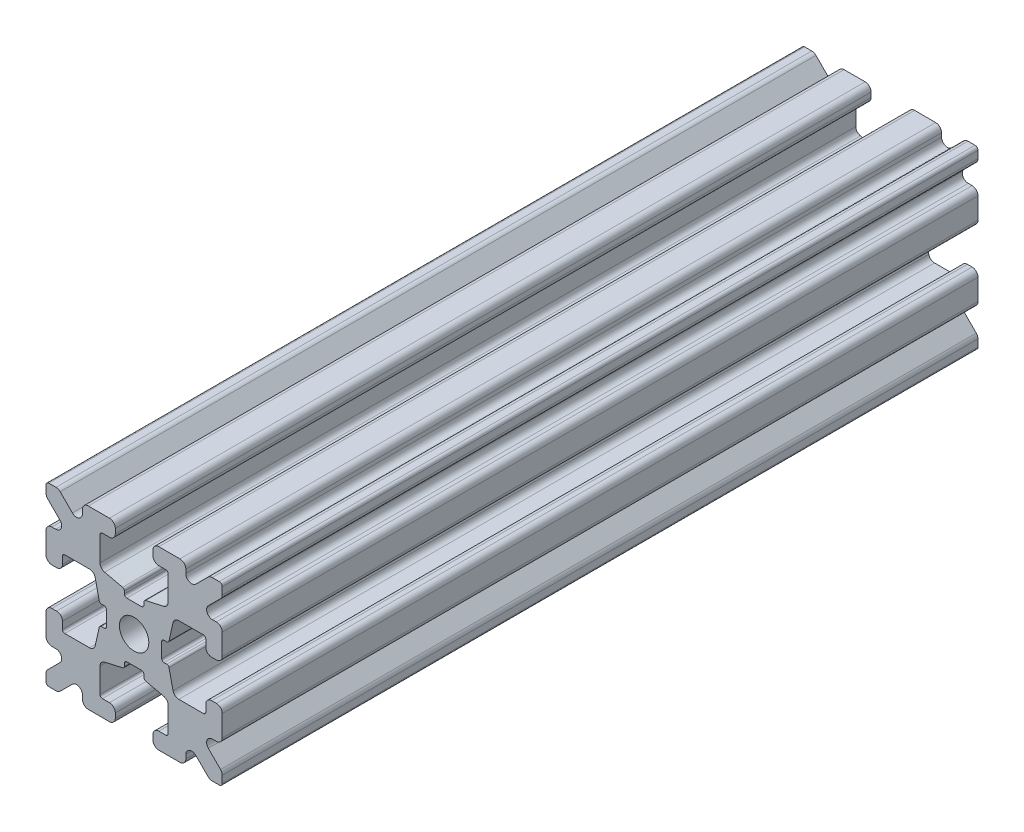
from build123d import *

# Parameters (mm, degrees)
SKETCH1_W           = 15
SKETCH1_H           = 15
SKETCH1_R           = 1.25
BOSS_EXTRUDE1_DEPTH = 32.16402
FILLET1_R           = 0.25
CUT_EXTRUDE1_DEPTH  = 66.196600603
CUT_EXTRUDE3_DEPTH  = 66.196600603
FILLET3_R           = 0.5
FILLET4_R           = 0.5
FILLET5_R           = 3
FILLET6_R           = 0.2
CUT_EXTRUDE4_DEPTH  = 66.196600603
FILLET8_R           = 0.5
SKETCH6_W           = 5.1529354
SKETCH6_H           = 1.651
SKETCH6_W_2         = 1.651
SKETCH6_H_2         = 5.1529354
CUT_EXTRUDE5_DEPTH  = 66.196600603
FILLET10_R          = 0.2


with BuildPart() as part:
    # Sketch1 → Boss-Extrude1 (new, symmetric)
    with BuildSketch(Plane.XY):
        Rectangle(SKETCH1_W, SKETCH1_H)
        Circle(SKETCH1_R, mode=Mode.SUBTRACT)
    extrude(amount=BOSS_EXTRUDE1_DEPTH, both=True)

    # Fillet1
    fillet1_edges = [part.edges().sort_by_distance(p)[0] for p in [
        (7.5, -7.5, 0),
        (-7.5, -7.5, 0),
        (7.5, 7.5, 0),
        (-7.5, 7.5, 0),
    ]]
    fillet(fillet1_edges, radius=FILLET1_R)

    # Sketch2 → Cut-Extrude1 (cut, through all)
    with BuildSketch(Plane.XY.offset(32.16402)):
        Polygon((-7.5, 1.6), (-6.1, 1.6), (-6.1, 2.9), (-3.4, 2.9), (-3.4, -2.9), (-6.1, -2.9), (-6.1, -1.6), (-7.5, -1.6), align=None)
        Polygon((2.9, 6.1), (1.6, 6.1), (1.6, 7.5), (-1.6, 7.5), (-1.6, 6.1), (-2.9, 6.1), (-2.9, 3.4), (2.9, 3.4), align=None)
        Polygon((-1.6, -7.5), (-1.6, -6.1), (-2.9, -6.1), (-2.9, -3.4), (2.9, -3.4), (2.9, -6.1), (1.6, -6.1), (1.6, -7.5), align=None)
        Polygon((6.1, -2.9), (6.1, -1.6), (7.5, -1.6), (7.5, 1.6), (6.1, 1.6), (6.1, 2.9), (3.4, 2.9), (3.4, -2.9), align=None)
    extrude(amount=-CUT_EXTRUDE1_DEPTH, mode=Mode.SUBTRACT)

    # Sketch4 → Cut-Extrude3 (cut, through all)
    with BuildSketch(Plane.XY.offset(32.16402)):
        Polygon((-3.4, 2.9), (-2.75, 0), (-3.4, -2.9), align=None)
        Polygon((-2.9, 3.4), (0, 2.75), (2.9, 3.4), align=None)
        Polygon((3.4, 2.9), (2.75, 0), (3.4, -2.9), align=None)
        Polygon((-2.9, -3.4), (0, -2.75), (2.9, -3.4), align=None)
    extrude(amount=-CUT_EXTRUDE3_DEPTH, mode=Mode.SUBTRACT)

    # Fillet3
    fillet3_edges = [part.edges().sort_by_distance(p)[0] for p in [
        (-6.1, -1.6, 0),
        (-7.5, -1.6, 0),
        (-6.1, 1.6, 0),
        (-7.5, 1.6, 0),
        (-1.6, -7.5, 0),
        (-1.6, -6.1, 0),
        (1.6, -7.5, 0),
        (1.6, -6.1, 0),
        (6.1, -1.6, 0),
        (7.5, -1.6, 0),
        (7.5, 1.6, 0),
        (6.1, 1.6, 0),
        (1.6, 7.5, 0),
        (1.6, 6.1, 0),
        (-1.6, 7.5, 0),
        (-1.6, 6.1, 0),
    ]]
    fillet(fillet3_edges, radius=FILLET3_R)

    # Fillet4
    fillet4_edges = [part.edges().sort_by_distance(p)[0] for p in [
        (-3.4, 2.9, 0),
        (-3.4, -2.9, 0),
        (2.9, -3.4, 0),
        (-2.9, -3.4, 0),
        (3.4, -2.9, 0),
        (3.4, 2.9, 0),
        (-2.9, 3.4, 0),
        (2.9, 3.4, 0),
    ]]
    fillet(fillet4_edges, radius=FILLET4_R)

    # Fillet5
    fillet5_edges = [part.edges().sort_by_distance(p)[0] for p in [
        (0, -2.75, 0),
        (2.75, 0, 0),
        (-2.75, 0, 0),
        (0, 2.75, 0),
    ]]
    fillet(fillet5_edges, radius=FILLET5_R)

    # Fillet6
    fillet6_edges = [part.edges().sort_by_distance(p)[0] for p in [
        (-2.9, -6.1, 0),
        (2.9, -6.1, 0),
        (6.1, -2.9, 0),
        (6.1, 2.9, 0),
        (2.9, 6.1, 0),
        (-2.9, 6.1, 0),
        (-6.1, -2.9, 0),
        (-6.1, 2.9, 0),
    ]]
    fillet(fillet6_edges, radius=FILLET6_R)

    # Sketch5 → Cut-Extrude4 (cut, through all)
    with BuildSketch(Plane.XY.offset(32.16402)):
        Polygon((-7.5, 6.439339828), (-5.460660172, 4.4), (-7.5, 4.4), align=None)
        Polygon((-6.439339828, 7.5), (-4.4, 5.460660172), (-4.4, 7.5), align=None)
        Polygon((4.4, 7.5), (6.439339828, 7.5), (4.4, 5.460660172), align=None)
        Polygon((7.5, 6.439339828), (7.5, 4.4), (5.460660172, 4.4), align=None)
        Polygon((7.5, -6.439339828), (5.460660172, -4.4), (7.5, -4.4), align=None)
        Polygon((6.439339828, -7.5), (4.4, -5.460660172), (4.4, -7.5), align=None)
        Polygon((-4.4, -7.5), (-6.439339828, -7.5), (-4.4, -5.460660172), align=None)
        Polygon((-7.5, -6.439339828), (-7.5, -4.4), (-5.460660172, -4.4), align=None)
    extrude(amount=-CUT_EXTRUDE4_DEPTH, mode=Mode.SUBTRACT)

    # Fillet8
    fillet8_edges = [part.edges().sort_by_distance(p)[0] for p in [
        (-5.460660172, 4.4, 0),
        (-7.5, 4.4, 0),
        (-5.460660172, -4.4, 0),
        (-7.5, -4.4, 0),
        (-4.4, -7.5, 0),
        (-4.4, -5.460660172, 0),
        (4.4, -7.5, 0),
        (4.4, -5.460660172, 0),
        (5.460660172, -4.4, 0),
        (7.5, -4.4, 0),
        (7.5, 4.4, 0),
        (5.460660172, 4.4, 0),
        (4.4, 5.460660172, 0),
        (4.4, 7.5, 0),
        (-4.4, 5.460660172, 0),
        (-4.4, 7.5, 0),
        (-6.439339828, 7.5, 0),
        (-7.5, 6.439339828, 0),
        (6.439339828, 7.5, 0),
        (7.5, 6.439339828, 0),
        (6.439339828, -7.5, 0),
        (7.5, -6.439339828, 0),
        (-6.439339828, -7.5, 0),
        (-7.5, -6.439339828, 0),
    ]]
    fillet(fillet8_edges, radius=FILLET8_R)

    # Sketch6 → Cut-Extrude5 (cut, through all)
    with BuildSketch(Plane.XY.offset(32.16402)):
        with Locations((4.9235323, 0)):
            Rectangle(SKETCH6_W, SKETCH6_H)
        with Locations((0, -4.9235323)):
            Rectangle(SKETCH6_W_2, SKETCH6_H_2)
        with Locations((-4.9235323, 0)):
            Rectangle(SKETCH6_W, SKETCH6_H)
        with Locations((0, 4.9235323)):
            Rectangle(SKETCH6_W_2, SKETCH6_H_2)
    extrude(amount=-CUT_EXTRUDE5_DEPTH, mode=Mode.SUBTRACT)

    # Fillet10
    fillet10_edges = [part.edges().sort_by_distance(p)[0] for p in [
        (-2.935025862, 0.8255, 0),
        (-2.935025862, -0.8255, 0),
        (2.935025862, -0.8255, 0),
        (2.935025862, 0.8255, 0),
        (0.8255, 2.935025862, 0),
        (-0.8255, 2.935025862, 0),
        (-2.3470646, 0.8255, 0),
        (-2.3470646, -0.8255, 0),
        (0.8255, 2.3470646, 0),
        (-0.8255, 2.3470646, 0),
        (2.3470646, 0.8255, 0),
        (2.3470646, -0.8255, 0),
        (0.8255, -2.935025862, 0),
        (0.8255, -2.3470646, 0),
        (-0.8255, -2.3470646, 0),
        (-0.8255, -2.935025862, 0),
    ]]
    fillet(fillet10_edges, radius=FILLET10_R)


solid = part.part
